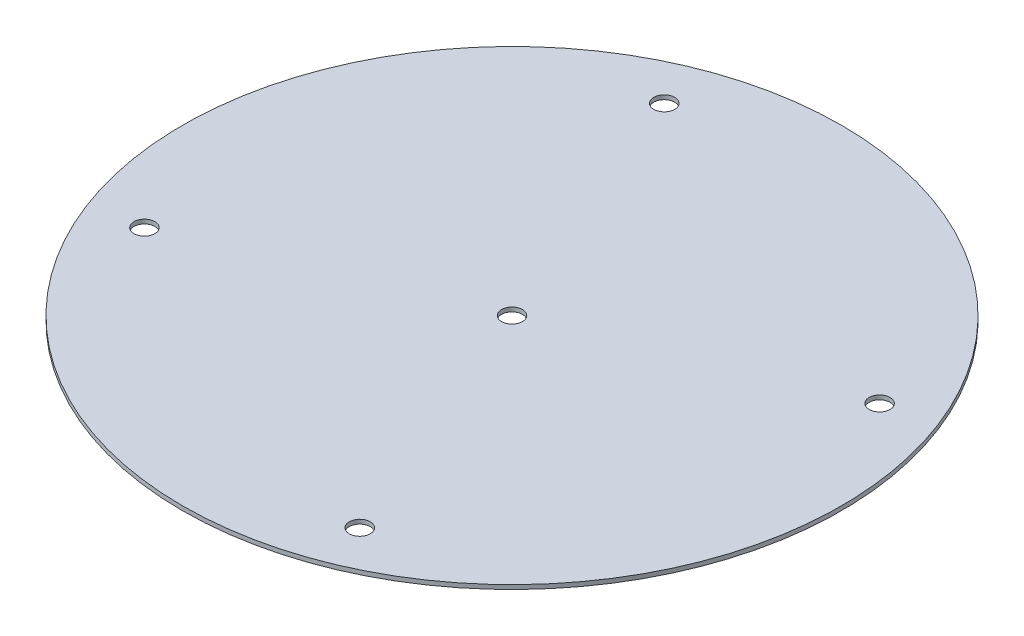
from build123d import *

# Parameters (mm, degrees)
SKETCH2_W                    = 77.55
SKETCH2_H                    = 1
F_10_0_1935_DIAMETER_HOLE1_D = 4.9149
CIRPATTERN3_COUNT            = 4
F_10_0_1935_DIAMETER_HOLE2_D = 4.9149


with BuildPart() as part:
    # Sketch2 → Revolve1 (revolve)
    with BuildSketch(Plane(origin=(0, 0, 0), x_dir=(0, 0, -1), z_dir=(1, 0, 0))):
        with Locations((-38.775, 0.5)):
            Rectangle(SKETCH2_W, SKETCH2_H)
    revolve(axis=Axis((0, -0.05, 0), (0, 1, 0)))

    # #10 (0.1935) Diameter Hole1 (through all)
    with Locations(Plane(origin=(0, 1, 0), x_dir=(1, 0, 0), z_dir=(0, 1, 0))):
        with Locations((-25.333643223, 61.160825052)):
            f_10_0_1935_diameter_hole1 = Hole(F_10_0_1935_DIAMETER_HOLE1_D / 2)

    # CirPattern3: #10 (0.1935) Diameter Hole1 ×4 about axis
    cirpattern3_axis = Axis((0, -0.05, 0), (0, 1, 0))
    for i in range(1, CIRPATTERN3_COUNT):
        add(f_10_0_1935_diameter_hole1.rotate(cirpattern3_axis, i * 360 / CIRPATTERN3_COUNT), mode=Mode.SUBTRACT)

    # #10 (0.1935) Diameter Hole2 (through all)
    with Locations(Plane(origin=(0, 1, 0), x_dir=(1, 0, 0), z_dir=(0, 1, 0))):
        with Locations((0, 0)):
            Hole(F_10_0_1935_DIAMETER_HOLE2_D / 2)


solid = part.part
